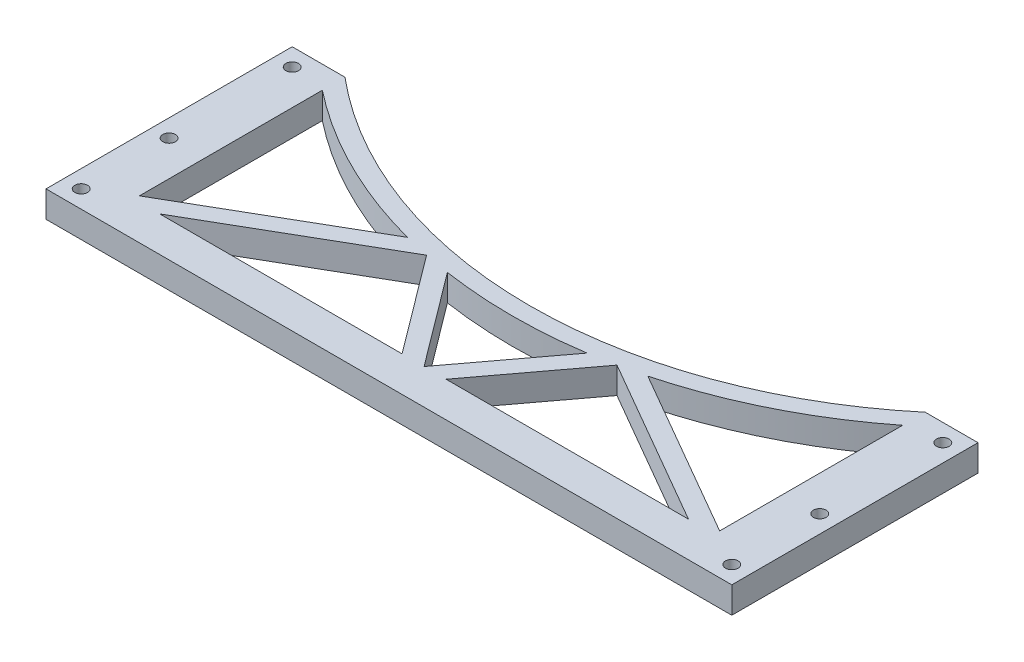
from build123d import *

# Parameters (mm, degrees)
BOSS_EXTRUDE1_DEPTH = 9.525
CUT_EXTRUDE1_DEPTH  = 153.730371079
SKETCH3_R           = 2.286
CUT_EXTRUDE2_DEPTH  = 153.730371079


with BuildPart() as part:
    # Sketch1 → Boss-Extrude1 (new body)
    with BuildSketch(Plane(origin=(0, 0, 0), x_dir=(1, 0, 0), z_dir=(0, 1, 0))):
        with BuildLine():
            Line((-123.825, 88.9), (-104.775, 88.9))
            ThreePointArc((-104.775, 88.9), (0, 50.8), (104.775, 88.9))
            Line((104.775, 88.9), (123.825, 88.9))
            Line((123.825, 88.9), (123.825, 0))
            Line((123.825, 0), (-123.825, 0))
            Line((-123.825, 0), (-123.825, 88.9))
        make_face()
    extrude(amount=BOSS_EXTRUDE1_DEPTH)

    # Sketch2 → Cut-Extrude1 (cut, through all)
    with BuildSketch(Plane(origin=(0, 9.525, 0), x_dir=(1, 0, 0), z_dir=(0, 1, 0))):
        with BuildLine():
            Line((-104.775, 80.721040156), (-104.775, 14.664696837))
            Line((-104.775, 14.664696837), (-43.397601252, 50.100954527))
            ThreePointArc((-43.397601252, 50.100954527), (-75.651684393, 62.273214358), (-104.775, 80.721040156))
        make_face()
        Polygon((-95.477954744, 12.7), (-7.93632453, 12.7), (-34.381137927, 47.974263636), align=None)
        with BuildLine():
            Line((0, 12.7), (-25.21715226, 46.336708401))
            ThreePointArc((-25.21715226, 46.336708401), (-12.643817033, 44.922335348), (0, 44.45))
            Line((0, 44.45), (0, 12.7))
        make_face()
    cut_extrude1 = extrude(amount=-CUT_EXTRUDE1_DEPTH, mode=Mode.SUBTRACT)

    # Mirror1: Cut-Extrude1 across plane
    add(cut_extrude1.mirror(Plane(origin=(0, 0, 0), x_dir=(0, 0, 1), z_dir=(1, 0, 0))), mode=Mode.SUBTRACT)

    # Sketch3 → Cut-Extrude2 (cut, through all)
    with BuildSketch(Plane(origin=(0, 9.525, 0), x_dir=(1, 0, 0), z_dir=(0, 1, 0))):
        with Locations((117.475, 82.55)):
            Circle(SKETCH3_R)
        with Locations((117.475, 6.35)):
            Circle(SKETCH3_R)
        with Locations((-117.475, 82.55)):
            Circle(SKETCH3_R)
        with Locations((-117.475, 6.35)):
            Circle(SKETCH3_R)
        with Locations((117.475, 38.1)):
            Circle(SKETCH3_R)
        with Locations((-117.475, 38.1)):
            Circle(SKETCH3_R)
    extrude(amount=-CUT_EXTRUDE2_DEPTH, mode=Mode.SUBTRACT)


solid = part.part
